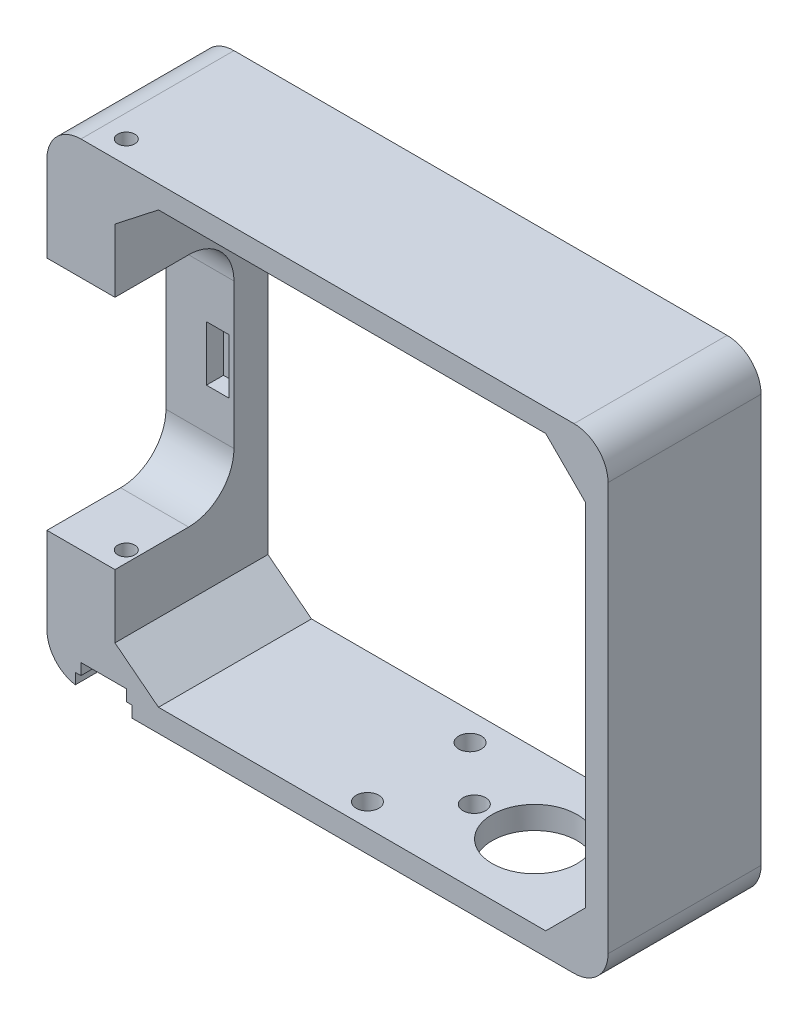
from build123d import *

# Parameters (mm, degrees)
SALIENTE_EXTRUIR1_DEPTH      = 3
SALIENTE_EXTRUIR1_DEPTH_BACK = 24
CROQUIS1_W                   = 99
CROQUIS1_H                   = 84
CROQUIS1_W_2                 = 83
CROQUIS1_H_2                 = 76
CHAFL_N1_SIZE                = 6
CHAFL_N1_SIZE2               = 7.679649793
CROQUIS10_R                  = 1.5
CORTAR_EXTRUIR6_DEPTH        = 109.830188826
CORTAR_EXTRUIR1_DEPTH        = 2
CORTAR_EXTRUIR5_DEPTH        = 2
CORTAR_EXTRUIR2_REACH        = 126.026
REDONDEO3_R                  = 6
CROQUIS12_R                  = 7.5
CROQUIS12_R_2                = 2
CORTAR_EXTRUIR7_DEPTH        = 70
CHAFL_N2_SIZE                = 7
CROQUIS17_W                  = 4
CROQUIS17_H                  = 9.7
CORTAR_EXTRUIR10_DEPTH       = 3


with BuildPart() as part:
    # Croquis1 → Saliente-Extruir1 (new, two sides: drawn at the far end of the back side and taken through both)
    with BuildSketch(Plane.XY.offset(-SALIENTE_EXTRUIR1_DEPTH_BACK)):
        with Locations((-15.4, 28.75)):
            Rectangle(CROQUIS1_W, CROQUIS1_H)
        with Locations((-11.4, 28.75)):
            Rectangle(CROQUIS1_W_2, CROQUIS1_H_2, mode=Mode.SUBTRACT)
    extrude(amount=SALIENTE_EXTRUIR1_DEPTH + SALIENTE_EXTRUIR1_DEPTH_BACK)

    # Chaflán1
    chafl_n1_edges = [part.edges().sort_by_distance(p)[0] for p in [
        (-52.9, 66.75, -10.5),
        (-52.9, -9.25, -10.5),
    ]]
    chafl_n1_side = [part.faces().sort_by_distance(p)[0] for p in [
        (-52.9, 28.75, -10.5),
    ]]
    chamfer(chafl_n1_edges, length=CHAFL_N1_SIZE, length2=CHAFL_N1_SIZE2, reference=chafl_n1_side[0])

    # Croquis10 → Cortar-Extruir6 (cut, through all)
    with BuildSketch(Plane(origin=(0, 70.75, 0), x_dir=(1, 0, 0), z_dir=(0, 1, 0))):
        with Locations((-54.9, 1)):
            Circle(CROQUIS10_R)
    extrude(amount=-CORTAR_EXTRUIR6_DEPTH, mode=Mode.SUBTRACT)

    # Croquis2 → Cortar-Extruir1 (cut)
    with BuildSketch(Plane(origin=(0, -13.25, 0), x_dir=(-1, 0, 0), z_dir=(0, -1, 0))):
        with BuildLine():
            Line((49.9, 1), (49.9, -3))
            Line((49.9, -3), (59.9, -3))
            Line((59.9, -3), (59.9, 1))
            ThreePointArc((59.9, 1), (54.9, 6), (49.9, 1))
        make_face()
    extrude(amount=-CORTAR_EXTRUIR1_DEPTH, mode=Mode.SUBTRACT)

    # Croquis9 → Cortar-Extruir5 (cut)
    with BuildSketch(Plane(origin=(0, -9.25, 0), x_dir=(1, 0, 0), z_dir=(0, 1, 0))):
        with BuildLine():
            Line((-57.389870926, 17.724817194), (-58.9, 1))
            Line((-58.9, 1), (-58.9, -3))
            Line((-58.9, -3), (-50.9, -3))
            Line((-50.9, -3), (-50.9, 1))
            Line((-50.9, 1), (-52.410129074, 17.724817194))
            ThreePointArc((-52.410129074, 17.724817194), (-54.9, 20), (-57.389870926, 17.724817194))
        make_face()
    extrude(amount=-CORTAR_EXTRUIR5_DEPTH, mode=Mode.SUBTRACT)

    # Croquis5 → Cortar-Extruir2 (cut, up to next)
    with BuildSketch(Plane.ZY.offset(64.9), mode=Mode.PRIVATE) as cortar_extruir2_sk1:
        with BuildLine():
            Line((-18, 41.55), (-18, 15.95))
            ThreePointArc((-18, 15.95), (-15.656854249, 10.293145751), (-10, 7.95))
            Line((-10, 7.95), (3, 7.95))
            Line((3, 7.95), (3, 49.55))
            Line((3, 49.55), (-10, 49.55))
            ThreePointArc((-10, 49.55), (-15.656854249, 47.206854249), (-18, 41.55))
        make_face()
    cortar_extruir2_tool1 = extrude(cortar_extruir2_sk1.sketch, amount=-CORTAR_EXTRUIR2_REACH, mode=Mode.PRIVATE) & part.part
    add(cortar_extruir2_tool1.solids().sort_by_distance((-64.9, 28.75, -7.217137))[0], mode=Mode.SUBTRACT)

    # Redondeo3
    redondeo3_edges = [part.edges().sort_by_distance(p)[0] for p in [
        (34.1, -13.25, -10.5),
        (34.1, 70.75, -10.5),
        (-64.9, -13.25, -10.5),
        (-64.9, 70.75, -10.5),
    ]]
    fillet(redondeo3_edges, radius=REDONDEO3_R)

    # Croquis12 → Cortar-Extruir7 (cut)
    with BuildSketch(Plane.XZ.offset(13.25)):
        with Locations((8.1, -10.05)):
            Circle(CROQUIS12_R)
        with Locations((-12.35, -1)):
            Circle(CROQUIS12_R_2)
        with Locations((-12.35, -19.1)):
            Circle(CROQUIS12_R_2)
        with Locations((-2.55, -10.05)):
            Circle(CROQUIS12_R_2)
    extrude(amount=-CORTAR_EXTRUIR7_DEPTH, mode=Mode.SUBTRACT)

    # Chaflán2
    chafl_n2_edges = [part.edges().sort_by_distance(p)[0] for p in [
        (30.1, 66.75, -10.5),
        (30.1, -9.25, -10.5),
    ]]
    chamfer(chafl_n2_edges, length=CHAFL_N2_SIZE)

    # Croquis17 → Cortar-Extruir10 (cut)
    with BuildSketch(Plane.XY.offset(-18)):
        with Locations((-55.75427784, 28.057124703)):
            Rectangle(CROQUIS17_W, CROQUIS17_H)
    extrude(amount=-CORTAR_EXTRUIR10_DEPTH, mode=Mode.SUBTRACT)


solid = part.part
